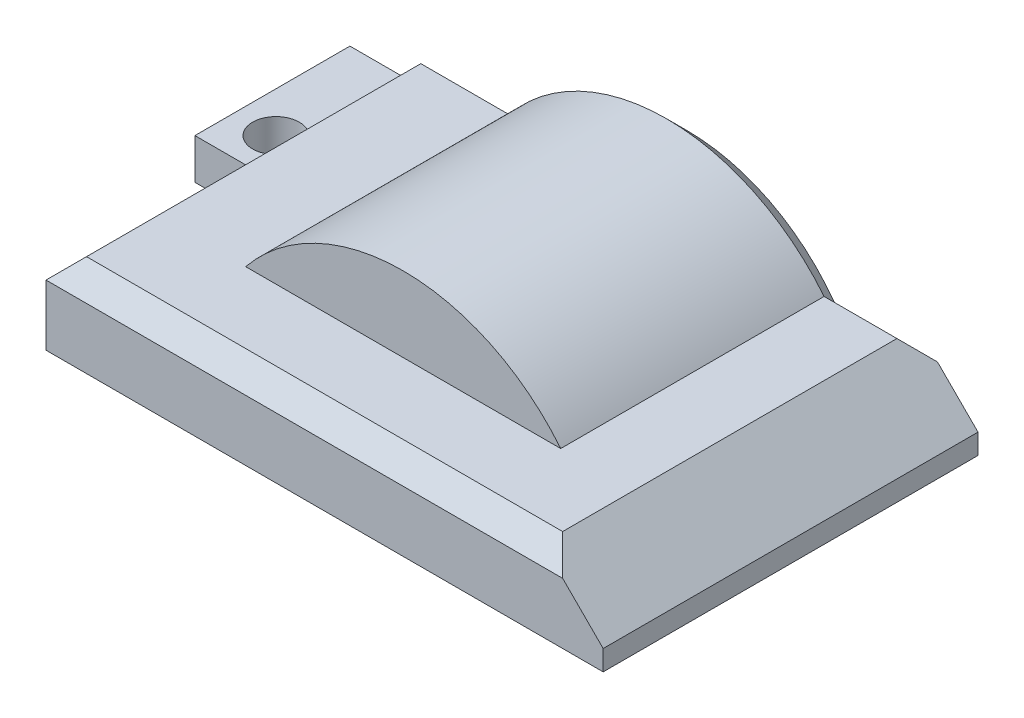
from build123d import *

# Parameters (mm, degrees)
SKETCH_1_W          = 27.5
SKETCH_1_H          = 20
SKETCH_1_W_2        = 23.5
SKETCH_1_H_2        = 16
EXTRUDE_1_DEPTH     = 2
CUT_EXTRUDE_1_REACH = 33.277
SKETCH_2_W          = 1.4
SKETCH_2_H          = 1.5
CUT_EXTRUDE_2_REACH = 33.277
SKETCH_3_W          = 1.4
SKETCH_3_H          = 1.5
EXTRUDE_2_DEPTH     = 2
EXTRUDE_3_DEPTH     = 11
SKETCH_6_W          = 27.5
SKETCH_6_H          = 7
EXTRUDE_4_DEPTH     = 2
EXTRUDE_START       = 13
EXTRUDE_5_DEPTH     = 13
EXTRUDE_6_DEPTH     = 1
CHAMFER_1_SIZE      = 3
SKETCH_9_W          = 3.5
SKETCH_9_H          = 7.65
SKETCH_9_R          = 1.15
EXTRUDE_7_DEPTH     = 2
CUT_EXTRUDE_3_REACH = 35.759
SKETCH_10_W         = 1.4
SKETCH_10_H         = 1.5
CUT_EXTRUDE_4_REACH = 33.731
SKETCH_11_R         = 2.25
CUT_EXTRUDE_5_REACH = 35.759
SKETCH_14_W         = 1.5
SKETCH_14_H         = 4
CHAMFER_2_SIZE      = 1
EXTRUDE_8_REACH     = 32.622
EXTRUDE_9_REACH     = 33.389


with BuildPart() as part:
    # 草图1 → 凸台-拉伸1 (new body)
    with BuildSketch(Plane(origin=(0, 0, 0), x_dir=(1, 0, 0), z_dir=(0, 1, 0))):
        with Locations((11.75, 8)):
            Rectangle(SKETCH_1_W, SKETCH_1_H)
        with Locations((11.75, 8)):
            Rectangle(SKETCH_1_W_2, SKETCH_1_H_2, mode=Mode.SUBTRACT)
    extrude(amount=EXTRUDE_1_DEPTH)

    # 草图2 → 切除-拉伸1 (cut, up to next)
    with BuildSketch(Plane.ZY.offset(-23.5), mode=Mode.PRIVATE) as cut_extrude_1_sk1:
        with Locations((-15.3, 0.75)):
            Rectangle(SKETCH_2_W, SKETCH_2_H)
    cut_extrude_1_tool1 = extrude(cut_extrude_1_sk1.sketch, amount=-CUT_EXTRUDE_1_REACH, mode=Mode.PRIVATE) & part.part
    # 草图2 → 切除-拉伸1 (cut, up to next)
    with BuildSketch(Plane.ZY.offset(-23.5), mode=Mode.PRIVATE) as cut_extrude_1_sk2:
        with Locations((-0.7, 0.75)):
            Rectangle(SKETCH_2_W, SKETCH_2_H)
    cut_extrude_1_tool2 = extrude(cut_extrude_1_sk2.sketch, amount=-CUT_EXTRUDE_1_REACH, mode=Mode.PRIVATE) & part.part
    add(cut_extrude_1_tool1.solids().sort_by_distance((23.5, 0.75, -15.3))[0], mode=Mode.SUBTRACT)
    add(cut_extrude_1_tool2.solids().sort_by_distance((23.5, 0.75, -0.7))[0], mode=Mode.SUBTRACT)

    # 草图3 → 切除-拉伸2 (cut, up to next)
    with BuildSketch(Plane(origin=(0, 0, 0), x_dir=(0, 0, -1), z_dir=(1, 0, 0)), mode=Mode.PRIVATE) as cut_extrude_2_sk1:
        with Locations((15.3, 0.75)):
            Rectangle(SKETCH_3_W, SKETCH_3_H)
    cut_extrude_2_tool1 = extrude(cut_extrude_2_sk1.sketch, amount=-CUT_EXTRUDE_2_REACH, mode=Mode.PRIVATE) & part.part
    add(cut_extrude_2_tool1.solids().sort_by_distance((0, 0.75, -15.3))[0], mode=Mode.SUBTRACT)

    # 草图4 → 凸台-拉伸2 (add)
    with BuildSketch(Plane(origin=(0, 0, -18), x_dir=(-1, 0, 0), z_dir=(0, 0, -1))):
        with BuildLine():
            Line((-20.163044891, 2), (-2.096955109, 2))
            ThreePointArc((-2.096955109, 2), (-11.13, 7.71), (-20.163044891, 2))
        make_face()
    extrude(amount=-EXTRUDE_2_DEPTH)

    # 草图5 → 凸台-拉伸3 (add)
    with BuildSketch(Plane.XY.offset(-16)):
        with BuildLine():
            Line((2.096955109, 2), (3.676416969, 2))
            ThreePointArc((3.676416969, 2), (11.13, 6.31), (18.583583031, 2))
            Line((18.583583031, 2), (20.163044891, 2))
            ThreePointArc((20.163044891, 2), (11.13, 7.71), (2.096955109, 2))
        make_face()
    extrude(amount=EXTRUDE_3_DEPTH)

    # 草图6 → 凸台-拉伸4 (add)
    with BuildSketch(Plane(origin=(0, 2, 0), x_dir=(1, 0, 0), z_dir=(0, 1, 0))):
        with Locations((11.75, 1.5)):
            Rectangle(SKETCH_6_W, SKETCH_6_H)
    extrude(amount=EXTRUDE_4_DEPTH)

    # 草图7 → 凸台-拉伸5 (add)
    with BuildSketch(Plane(origin=(0, 0, -5), x_dir=(-1, 0, 0), z_dir=(0, 0, -1)).offset(EXTRUDE_START)):
        with BuildLine():
            Line((2, 4), (-3.355947003, 4))
            ThreePointArc((-3.355947003, 4), (-2.667161537, 3.037322512), (-2.096955109, 2))
            Line((-2.096955109, 2), (0, 2))
            Line((0, 2), (2, 2))
            Line((2, 2), (2, 4))
        make_face()
        with BuildLine():
            Line((-23.5, 2), (-20.163044891, 2))
            ThreePointArc((-20.163044891, 2), (-19.592838463, 3.037322512), (-18.904052997, 4))
            Line((-18.904052997, 4), (-25.5, 4))
            Line((-25.5, 4), (-25.5, 2))
            Line((-25.5, 2), (-23.5, 2))
        make_face()
    extrude(amount=-EXTRUDE_5_DEPTH)

    # 草图8 → 凸台-拉伸6 (add)
    with BuildSketch(Plane.XY.offset(-5)):
        with BuildLine():
            Line((3.355947003, 4), (18.904052997, 4))
            ThreePointArc((18.904052997, 4), (11.13, 7.71), (3.355947003, 4))
        make_face()
    extrude(amount=EXTRUDE_6_DEPTH)

    # 倒角1
    # the kernel refuses this chamfer: 3 mm, written as the material it takes off along each edge
    with BuildSketch(Plane(origin=(25.5, 4, 9.715048964), x_dir=(0.027495876610586778, -0.9996219169112968, 0), z_dir=(0, 0, -1))) as chamfer_1_piece_1:
        Polygon((CHAMFER_1_SIZE * 0.999621916911, CHAMFER_1_SIZE * 0.0274958766106), (-CHAMFER_1_SIZE * 0.0274958766106, CHAMFER_1_SIZE * 0.999621916911), (0, 0), align=None)
    extrude(amount=35.430097928, mode=Mode.SUBTRACT)

    # 草图9 → 凸台-拉伸7 (add)
    with BuildSketch(Plane.XZ):
        with Locations((-3.75, -14.175)):
            Rectangle(SKETCH_9_W, SKETCH_9_H)
        with Locations(Location((-3.5, -12.35, 0), (0, 0, 270))):
            Circle(SKETCH_9_R, mode=Mode.SUBTRACT)
    extrude(amount=-EXTRUDE_7_DEPTH)

    # 草图10 → 切除-拉伸3 (cut, up to next)
    with BuildSketch(Plane(origin=(-2, 0, 0), x_dir=(0, 0, -1), z_dir=(1, 0, 0)), mode=Mode.PRIVATE) as cut_extrude_3_sk1:
        with Locations((15.3, 0.75)):
            Rectangle(SKETCH_10_W, SKETCH_10_H)
    cut_extrude_3_tool1 = extrude(cut_extrude_3_sk1.sketch, amount=-CUT_EXTRUDE_3_REACH, mode=Mode.PRIVATE) & part.part
    add(cut_extrude_3_tool1.solids().sort_by_distance((-2, 0.75, -15.3))[0], mode=Mode.SUBTRACT)

    # 草图11 → 切除-拉伸4 (cut, up to next)
    with BuildSketch(Plane(origin=(0, 2, 0), x_dir=(1, 0, 0), z_dir=(0, 1, 0)), mode=Mode.PRIVATE) as cut_extrude_4_sk1:
        with Locations((-3.5, 12.35)):
            Circle(SKETCH_11_R)
    cut_extrude_4_tool1 = extrude(cut_extrude_4_sk1.sketch, amount=CUT_EXTRUDE_4_REACH, mode=Mode.PRIVATE) & part.part
    add(cut_extrude_4_tool1.solids().sort_by_distance((-3.5, 2, -12.35))[0], mode=Mode.SUBTRACT)

    # 草图14 → 切除-拉伸5 (cut, up to next)
    with BuildSketch(Plane.ZY.offset(2), mode=Mode.PRIVATE) as cut_extrude_5_sk1:
        with Locations((1.25, 2)):
            Rectangle(SKETCH_14_W, SKETCH_14_H)
    cut_extrude_5_tool1 = extrude(cut_extrude_5_sk1.sketch, amount=-CUT_EXTRUDE_5_REACH, mode=Mode.PRIVATE) & part.part
    add(cut_extrude_5_tool1.solids().sort_by_distance((-2, 2, 1.25))[0], mode=Mode.SUBTRACT)

    # 倒角2
    chamfer_2_edges = [part.edges().sort_by_distance(p)[0] for p in [
        (-2, 4, -16.013525492),
    ]]
    chamfer(chamfer_2_edges, length=CHAMFER_2_SIZE)
    chamfer_2_2_edges = [part.edges().sort_by_distance(p)[0] for p in [
        (1.177973502, 4, -18),
    ]]
    chamfer(chamfer_2_2_edges, length=CHAMFER_2_SIZE)
    chamfer_2_3_edges = [part.edges().sort_by_distance(p)[0] for p in [
        (20.702026498, 4, -18),
    ]]
    chamfer(chamfer_2_3_edges, length=CHAMFER_2_SIZE)
    chamfer_2_4_edges = [part.edges().sort_by_distance(p)[0] for p in [
        (10.75, 4, 0.5),
    ]]
    chamfer(chamfer_2_4_edges, length=CHAMFER_2_SIZE)
    chamfer_2_5_edges = [part.edges().sort_by_distance(p)[0] for p in [
        (11.13, 7.71, -18),
    ]]
    chamfer(chamfer_2_5_edges, length=CHAMFER_2_SIZE)

    # 草图12 → 凸台-拉伸8 (add, up to next)
    with BuildSketch(Plane(origin=(0, 0, -14.6), x_dir=(-1, 0, 0), z_dir=(0, 0, -1)), mode=Mode.PRIVATE) as extrude_8_sk1:
        Polygon((-23.5, 1.5), (-25, 1.5), (-25.5, 1), (-25.5, 0), (-23.5, 0), align=None)
    extrude_8_tool1 = extrude(extrude_8_sk1.sketch, amount=EXTRUDE_8_REACH, mode=Mode.PRIVATE) - part.part
    add(extrude_8_tool1.solids().sort_by_distance((24.463768, 0.724638, -14.6))[0])

    # 草图13 → 凸台-拉伸9 (add, up to next)
    with BuildSketch(Plane.XY.offset(-1.4), mode=Mode.PRIVATE) as extrude_9_sk1:
        Polygon((25.5, 0), (25.5, 1), (25, 1.5), (23.5, 1.5), (23.5, 0), align=None)
    extrude_9_tool1 = extrude(extrude_9_sk1.sketch, amount=EXTRUDE_9_REACH, mode=Mode.PRIVATE) - part.part
    add(extrude_9_tool1.solids().sort_by_distance((24.463768, 0.724638, -1.4))[0])


solid = part.part
